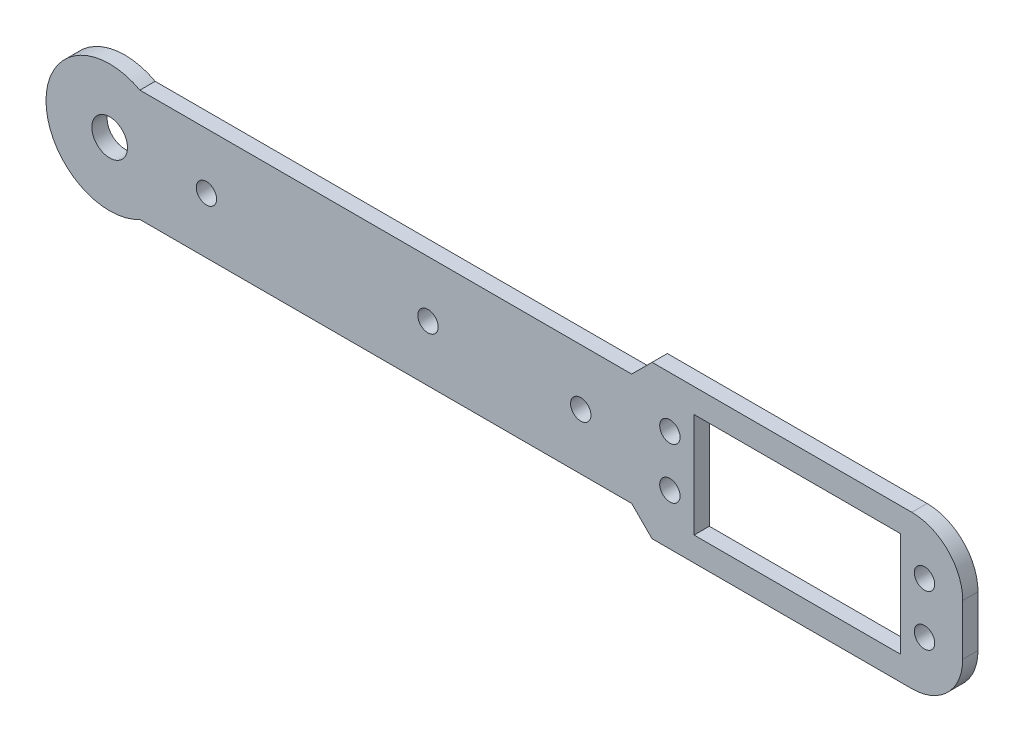
from build123d import *

# Parameters (mm, degrees)
SALIENTE_EXTRUIR1_DEPTH = 3
REDONDEO1_R             = 10
CHAFL_N1_SIZE           = 4
CORTAR_EXTRUIR1_REACH   = 93.291
CROQUIS2_R              = 2
CROQUIS2_W              = 40.5
CROQUIS2_H              = 20.5
CORTAR_EXTRUIR2_REACH   = 93.291
CROQUIS3_R              = 3.5
CROQUIS3_R_2            = 2
CORTAR_EXTRUIR3_REACH   = 93.291
CROQUIS4_R              = 2


with BuildPart() as part:
    # Croquis1 → Saliente-Extruir1 (new body)
    with BuildSketch(Plane.XY):
        with BuildLine():
            Line((90, -15), (90, 15))
            Line((90, 15), (25, 15))
            Line((25, 15), (25, 11))
            Line((25, 11), (-25, 11))
            Line((-25, 11), (-71.562828956, 11))
            ThreePointArc((-71.562828956, 11), (-90, 0), (-71.562828956, -11))
            Line((-71.562828956, -11), (-25, -11))
            Line((-25, -11), (25, -11))
            Line((25, -11), (25, -15))
            Line((25, -15), (90, -15))
        make_face()
    extrude(amount=SALIENTE_EXTRUIR1_DEPTH)

    # Redondeo1
    redondeo1_edges = [part.edges().sort_by_distance(p)[0] for p in [
        (90, 15, 1.5),
        (90, -15, 1.5),
    ]]
    fillet(redondeo1_edges, radius=REDONDEO1_R)

    # Chaflán1
    chafl_n1_edges = [part.edges().sort_by_distance(p)[0] for p in [
        (25, -15, 1.5),
        (25, 15, 1.5),
    ]]
    chamfer(chafl_n1_edges, length=CHAFL_N1_SIZE - 0.0001)  # a hair under: the kernel refuses the full size

    # Croquis2 → Cortar-Extruir1 (cut, up to next)
    with BuildSketch(Plane.XY.offset(3), mode=Mode.PRIVATE) as cortar_extruir1_sk1:
        with Locations((82.5, 5)):
            Circle(CROQUIS2_R)
    cortar_extruir1_tool1 = extrude(cortar_extruir1_sk1.sketch, amount=-CORTAR_EXTRUIR1_REACH, mode=Mode.PRIVATE) & part.part
    # Croquis2 → Cortar-Extruir1 (cut, up to next)
    with BuildSketch(Plane.XY.offset(3), mode=Mode.PRIVATE) as cortar_extruir1_sk2:
        with Locations((32.5, 5)):
            Circle(CROQUIS2_R)
    cortar_extruir1_tool2 = extrude(cortar_extruir1_sk2.sketch, amount=-CORTAR_EXTRUIR1_REACH, mode=Mode.PRIVATE) & part.part
    # Croquis2 → Cortar-Extruir1 (cut, up to next)
    with BuildSketch(Plane.XY.offset(3), mode=Mode.PRIVATE) as cortar_extruir1_sk3:
        with Locations((82.5, -5)):
            Circle(CROQUIS2_R)
    cortar_extruir1_tool3 = extrude(cortar_extruir1_sk3.sketch, amount=-CORTAR_EXTRUIR1_REACH, mode=Mode.PRIVATE) & part.part
    # Croquis2 → Cortar-Extruir1 (cut, up to next)
    with BuildSketch(Plane.XY.offset(3), mode=Mode.PRIVATE) as cortar_extruir1_sk4:
        with Locations((32.5, -5)):
            Circle(CROQUIS2_R)
    cortar_extruir1_tool4 = extrude(cortar_extruir1_sk4.sketch, amount=-CORTAR_EXTRUIR1_REACH, mode=Mode.PRIVATE) & part.part
    # Croquis2 → Cortar-Extruir1 (cut, up to next)
    with BuildSketch(Plane.XY.offset(3), mode=Mode.PRIVATE) as cortar_extruir1_sk5:
        with Locations((57.5, 0)):
            Rectangle(CROQUIS2_W, CROQUIS2_H)
    cortar_extruir1_tool5 = extrude(cortar_extruir1_sk5.sketch, amount=-CORTAR_EXTRUIR1_REACH, mode=Mode.PRIVATE) & part.part
    add(cortar_extruir1_tool1.solids().sort_by_distance((82.5, 5, 3))[0], mode=Mode.SUBTRACT)
    add(cortar_extruir1_tool2.solids().sort_by_distance((32.5, 5, 3))[0], mode=Mode.SUBTRACT)
    add(cortar_extruir1_tool3.solids().sort_by_distance((82.5, -5, 3))[0], mode=Mode.SUBTRACT)
    add(cortar_extruir1_tool4.solids().sort_by_distance((32.5, -5, 3))[0], mode=Mode.SUBTRACT)
    add(cortar_extruir1_tool5.solids().sort_by_distance((57.5, 0, 3))[0], mode=Mode.SUBTRACT)

    # Croquis3 → Cortar-Extruir2 (cut, up to next)
    with BuildSketch(Plane.XY.offset(3), mode=Mode.PRIVATE) as cortar_extruir2_sk1:
        with Locations((-77.5, 0)):
            Circle(CROQUIS3_R)
    cortar_extruir2_tool1 = extrude(cortar_extruir2_sk1.sketch, amount=-CORTAR_EXTRUIR2_REACH, mode=Mode.PRIVATE) & part.part
    # Croquis3 → Cortar-Extruir2 (cut, up to next)
    with BuildSketch(Plane.XY.offset(3), mode=Mode.PRIVATE) as cortar_extruir2_sk2:
        with Locations((-58.5, 0)):
            Circle(CROQUIS3_R_2)
    cortar_extruir2_tool2 = extrude(cortar_extruir2_sk2.sketch, amount=-CORTAR_EXTRUIR2_REACH, mode=Mode.PRIVATE) & part.part
    add(cortar_extruir2_tool1.solids().sort_by_distance((-77.5, 0, 3))[0], mode=Mode.SUBTRACT)
    add(cortar_extruir2_tool2.solids().sort_by_distance((-58.5, 0, 3))[0], mode=Mode.SUBTRACT)

    # Croquis4 → Cortar-Extruir3 (cut, up to next)
    with BuildSketch(Plane.XY.offset(3), mode=Mode.PRIVATE) as cortar_extruir3_sk1:
        with Locations((-15, 0)):
            Circle(CROQUIS4_R)
    cortar_extruir3_tool1 = extrude(cortar_extruir3_sk1.sketch, amount=-CORTAR_EXTRUIR3_REACH, mode=Mode.PRIVATE) & part.part
    # Croquis4 → Cortar-Extruir3 (cut, up to next)
    with BuildSketch(Plane.XY.offset(3), mode=Mode.PRIVATE) as cortar_extruir3_sk2:
        with Locations((15, 0)):
            Circle(CROQUIS4_R)
    cortar_extruir3_tool2 = extrude(cortar_extruir3_sk2.sketch, amount=-CORTAR_EXTRUIR3_REACH, mode=Mode.PRIVATE) & part.part
    add(cortar_extruir3_tool1.solids().sort_by_distance((-15, 0, 3))[0], mode=Mode.SUBTRACT)
    add(cortar_extruir3_tool2.solids().sort_by_distance((15, 0, 3))[0], mode=Mode.SUBTRACT)


solid = part.part
